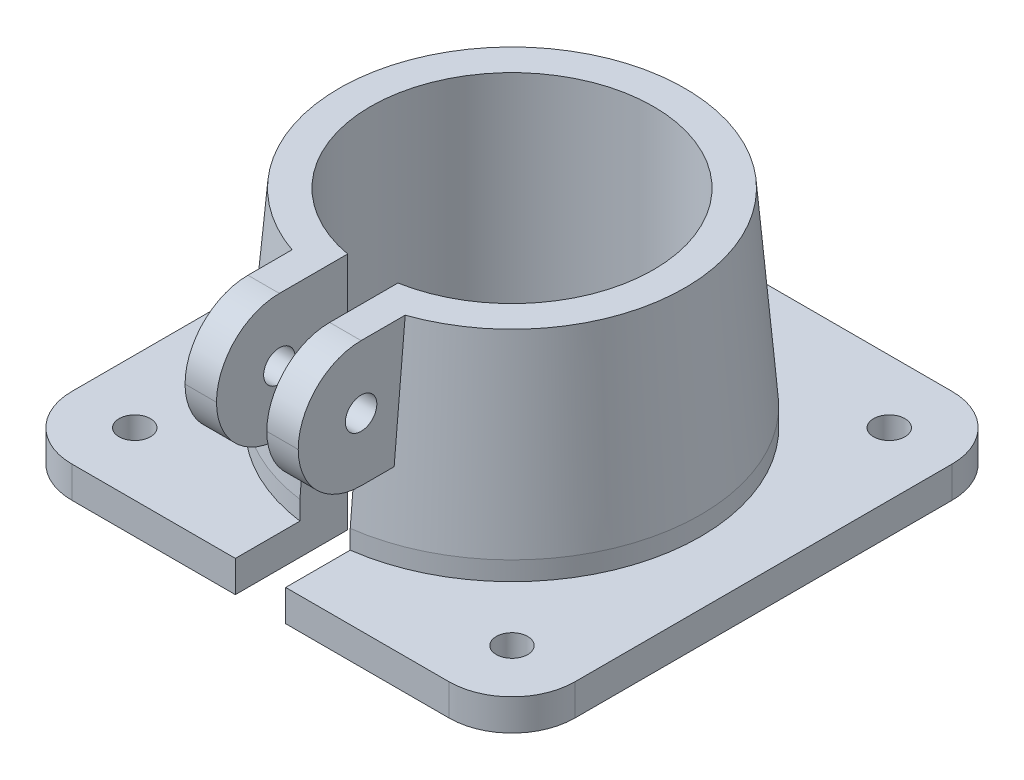
from build123d import *

# Parameters (mm, degrees)
BOSS_EXTRUDE1_DEPTH     = 5
SKETCH2_R               = 30
BOSS_EXTRUDE2_DEPTH     = 3
SKETCH3_R               = 27.5
BOSS_EXTRUDE3_DEPTH     = 30
SKETCH4_R               = 22.5
CUT_EXTRUDE1_DEPTH      = 69.14690015
SKETCH6_R               = 22.5
CUT_EXTRUDE2_DEPTH      = 69.14690015
CUT_EXTRUDE5_DEPTH      = 69.146900205
CUT_EXTRUDE5_DEPTH_BACK = 13
SKETCH7_W               = 8
SKETCH7_H               = 27.467309478
SKETCH8_W               = 5
SKETCH8_H               = 20
BOSS_EXTRUDE4_DEPTH     = 43
FILLET1_R               = 10
SKETCH9_R               = 2.5
CUT_EXTRUDE6_DEPTH      = 43
SKETCH10_R              = 22.5
CUT_EXTRUDE7_DEPTH      = 43
SKETCH11_R              = 2.5
CUT_EXTRUDE8_DEPTH      = 10


with BuildPart() as part:
    # Sketch1 → Boss-Extrude1 (new body)
    with BuildSketch(Plane(origin=(0, 0, 0), x_dir=(1, 0, 0), z_dir=(0, 1, 0))):
        with BuildLine():
            Line((30, -40), (-30, -40))
            ThreePointArc((-30, -40), (-37.071067812, -37.071067812), (-40, -30))
            Line((-40, -30), (-40, 30))
            ThreePointArc((-40, 30), (-37.071067812, 37.071067812), (-30, 40))
            Line((-30, 40), (30, 40))
            ThreePointArc((30, 40), (37.071067812, 37.071067812), (40, 30))
            Line((40, 30), (40, -30))
            ThreePointArc((40, -30), (37.071067812, -37.071067812), (30, -40))
        make_face()
    extrude(amount=BOSS_EXTRUDE1_DEPTH)

    # Sketch2 → Boss-Extrude2 (add)
    with BuildSketch(Plane(origin=(0, 5, 0), x_dir=(1, 0, 0), z_dir=(0, 1, 0))):
        with Locations(Location((0, 0, 0), (0, 0, 270))):
            Circle(SKETCH2_R)
    extrude(amount=BOSS_EXTRUDE2_DEPTH)

    # Sketch3 → Boss-Extrude3 (add)
    with BuildSketch(Plane(origin=(0, 8, 0), x_dir=(1, 0, 0), z_dir=(0, 1, 0))):
        with Locations(Location((0, 0, 0), (0, 0, 270))):
            Circle(SKETCH3_R)
    extrude(amount=BOSS_EXTRUDE3_DEPTH)

    # Sketch4 → Cut-Extrude1 (cut, through all)
    with BuildSketch(Plane(origin=(0, 38, 0), x_dir=(1, 0, 0), z_dir=(0, 1, 0))):
        with Locations(Location((0, 0, 0), (0, 0, 270))):
            Circle(SKETCH4_R)
    extrude(amount=-CUT_EXTRUDE1_DEPTH, mode=Mode.SUBTRACT)

    # loft up to a face of the part (loft1)
    loft([Face(Wire([part.edges().sort_by_distance((21.869058823, 8, -20.536413178))[0]])), Face(Wire([part.edges().sort_by_distance((-20.046637254, 38, -18.825045413))[0]]))])

    # Sketch6 → Cut-Extrude2 (cut, through all)
    with BuildSketch(Plane(origin=(0, 38, 0), x_dir=(1, 0, 0), z_dir=(0, 1, 0))):
        with Locations(Location((0, 0, 0), (0, 0, 270))):
            Circle(SKETCH6_R)
    extrude(amount=-CUT_EXTRUDE2_DEPTH, mode=Mode.SUBTRACT)

    # Sketch7 → Cut-Extrude5 (cut, two sides: drawn at the far end of the back side and taken through both)
    with BuildSketch(Plane(origin=(0, 0, 0), x_dir=(1, 0, 0), z_dir=(0, 1, 0)).offset(-CUT_EXTRUDE5_DEPTH_BACK)):
        with Locations((0, -26.266345261)):
            Rectangle(SKETCH7_W, SKETCH7_H)
    extrude(amount=CUT_EXTRUDE5_DEPTH + CUT_EXTRUDE5_DEPTH_BACK, mode=Mode.SUBTRACT)

    # Sketch8 → Boss-Extrude4 (add)
    with BuildSketch(Plane.XY):
        with Locations((-6.5, 28)):
            Rectangle(SKETCH8_W, SKETCH8_H)
        with Locations((6.5, 28)):
            Rectangle(SKETCH8_W, SKETCH8_H)
    extrude(amount=BOSS_EXTRUDE4_DEPTH)

    # Fillet1
    fillet1_edges = [part.edges().sort_by_distance(p)[0] for p in [
        (6.5, 18, 43),
        (-6.5, 18, 43),
        (6.5, 38, 43),
        (-6.5, 38, 43),
    ]]
    fillet(fillet1_edges, radius=FILLET1_R - 0.0001)  # a hair under: the kernel refuses the full size

    # Sketch9 → Cut-Extrude6 (cut)
    with BuildSketch(Plane(origin=(9, 0, 0), x_dir=(0, 0, -1), z_dir=(1, 0, 0))):
        with Locations(Location((-33, 28, 0), (0, 0, 90))):
            Circle(SKETCH9_R)
    extrude(amount=-CUT_EXTRUDE6_DEPTH, mode=Mode.SUBTRACT)

    # Sketch10 → Cut-Extrude7 (cut)
    with BuildSketch(Plane(origin=(0, 38, 0), x_dir=(1, 0, 0), z_dir=(0, 1, 0))):
        Circle(SKETCH10_R)
    extrude(amount=-CUT_EXTRUDE7_DEPTH, mode=Mode.SUBTRACT)

    # Sketch11 → Cut-Extrude8 (cut)
    with BuildSketch(Plane(origin=(0, 5, 0), x_dir=(1, 0, 0), z_dir=(0, 1, 0))):
        with Locations(Location((30, -30, 0), (0, 0, 270))):
            Circle(SKETCH11_R)
        with Locations(Location((-30, -30, 0), (0, 0, 270))):
            Circle(SKETCH11_R)
        with Locations(Location((30, 30, 0), (0, 0, 270))):
            Circle(SKETCH11_R)
        with Locations(Location((-30, 30, 0), (0, 0, 270))):
            Circle(SKETCH11_R)
    extrude(amount=-CUT_EXTRUDE8_DEPTH, mode=Mode.SUBTRACT)


solid = part.part
